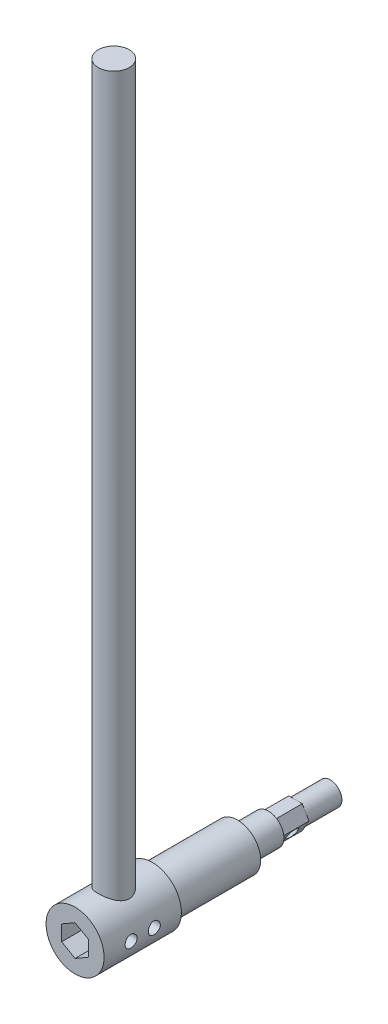
from build123d import *

# Parameters (mm, degrees)
SKETCH1_R                = 7.5
BOSS_EXTRUDE1_DEPTH      = 20
BOSS_EXTRUDE3_REACH      = 203.137
BOSS_EXTRUDE3_END_RADIUS = 7.5
SKETCH6_R                = 4
CUT_EXTRUDE1_DEPTH       = 7.5
CUT_EXTRUDE1_DEPTH_BACK  = 7.5
SKETCH8_R                = 1.55
SKETCH11_R               = 6
BOSS_EXTRUDE12_DEPTH     = 22
SKETCH12_R               = 4
BOSS_EXTRUDE13_DEPTH     = 8
BOSS_EXTRUDE14_DEPTH     = 7
SKETCH14_R               = 1.55
CUT_EXTRUDE2_DEPTH       = 6.1
SKETCH15_R               = 3
BOSS_EXTRUDE15_DEPTH     = 9


with BuildPart() as part:
    # Sketch1 → Boss-Extrude1 (new body)
    with BuildSketch(Plane.XY):
        Circle(SKETCH1_R)
        Polygon((0, 4), (3.464101615, 2), (3.464101615, -2), (0, -4), (-3.464101615, -2), (-3.464101615, 2), align=None, mode=Mode.SUBTRACT)
    extrude(amount=BOSS_EXTRUDE1_DEPTH)

    # Boss-Extrude3: up to this cylinder (the profile starts outside it)
    boss_extrude3_end = Plane(origin=(0, 0, 10), z_dir=(0, 0, -1)) * Cylinder(BOSS_EXTRUDE3_END_RADIUS, 422.274, mode=Mode.PRIVATE)
    # Sketch6 → Boss-Extrude3 (add, up to the surface)
    with BuildSketch(Plane(origin=(0, 192.5, 0), x_dir=(1, 0, 0), z_dir=(0, 1, 0)), mode=Mode.PRIVATE) as boss_extrude3_sk1:
        with Locations((0, -10)):
            Circle(SKETCH6_R)
    boss_extrude3_tool1 = extrude(boss_extrude3_sk1.sketch, amount=-BOSS_EXTRUDE3_REACH, mode=Mode.PRIVATE) - boss_extrude3_end
    add(boss_extrude3_tool1.solids().sort_by_distance((0, 192.5, 10))[0])

    # Sketch8 → Cut-Extrude1 (cut, two sides: drawn at the far end of the back side and taken through both)
    with BuildSketch(Plane.ZY.offset(-CUT_EXTRUDE1_DEPTH_BACK)):
        with Locations((7, 0)):
            Circle(SKETCH8_R)
        with Locations((13, 0)):
            Circle(SKETCH8_R)
    extrude(amount=CUT_EXTRUDE1_DEPTH + CUT_EXTRUDE1_DEPTH_BACK, mode=Mode.SUBTRACT)

    # Sketch11 → Boss-Extrude12 (add)
    with BuildSketch(Plane(origin=(0, 0, 0), x_dir=(-1, 0, 0), z_dir=(0, 0, -1))):
        Circle(SKETCH11_R)
    extrude(amount=BOSS_EXTRUDE12_DEPTH)

    # Sketch12 → Boss-Extrude13 (add)
    with BuildSketch(Plane(origin=(0, 0, -22), x_dir=(-1, 0, 0), z_dir=(0, 0, -1))):
        Circle(SKETCH12_R)
    extrude(amount=BOSS_EXTRUDE13_DEPTH)

    # Sketch13 → Boss-Extrude14 (add)
    with BuildSketch(Plane(origin=(0, 0, -30), x_dir=(-1, 0, 0), z_dir=(0, 0, -1))):
        Polygon((1.75, 3.031088913), (-1.75, 3.031088913), (-3.5, 0), (-1.75, -3.031088913), (1.75, -3.031088913), (3.5, 0), align=None)
    extrude(amount=BOSS_EXTRUDE14_DEPTH)

    # Sketch14 → Cut-Extrude2 (cut)
    with BuildSketch(Plane(origin=(2.625, -1.515544457, 0), x_dir=(0, 0, -1), z_dir=(0.866025403784438, -0.5000000000000012, 0))):
        with Locations((33.5, 0)):
            Circle(SKETCH14_R)
    extrude(amount=-CUT_EXTRUDE2_DEPTH, mode=Mode.SUBTRACT)

    # Sketch15 → Boss-Extrude15 (add)
    with BuildSketch(Plane(origin=(0, 0, -37), x_dir=(-1, 0, 0), z_dir=(0, 0, -1))):
        Circle(SKETCH15_R)
    extrude(amount=BOSS_EXTRUDE15_DEPTH)


solid = part.part
